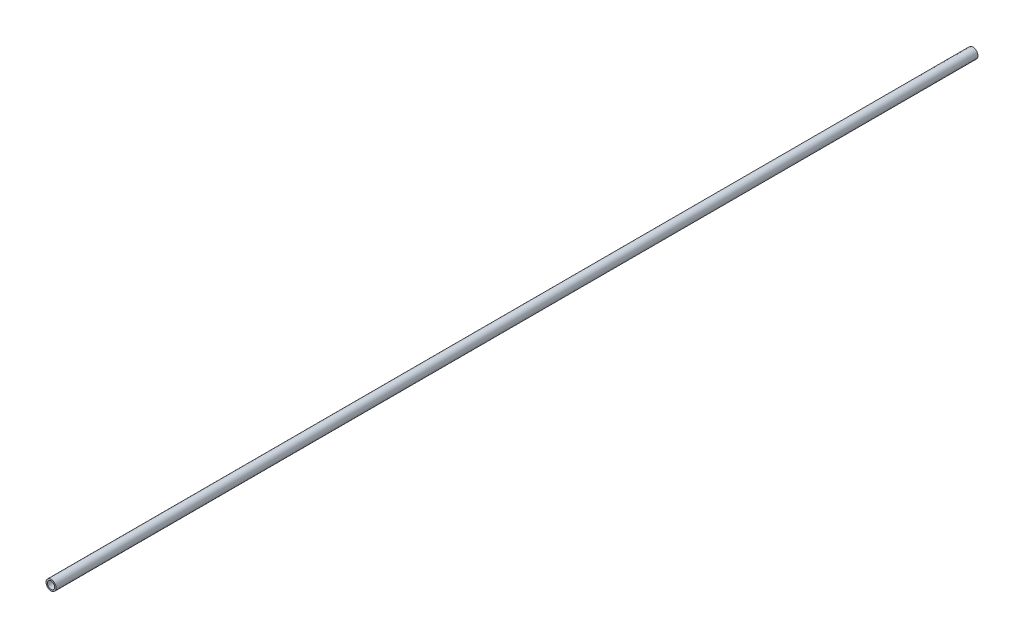
from build123d import *

# Parameters (mm, degrees)
SKETCH1_R           = 16.7005
SKETCH1_R_2         = 12.1539
EXTRUDE_THIN1_DEPTH = 1524


with BuildPart() as part:
    # Sketch1 → Extrude-Thin1 (new, symmetric)
    with BuildSketch(Plane.XY):
        Circle(SKETCH1_R)
        Circle(SKETCH1_R_2, mode=Mode.SUBTRACT)
    extrude(amount=EXTRUDE_THIN1_DEPTH, both=True)


solid = part.part
